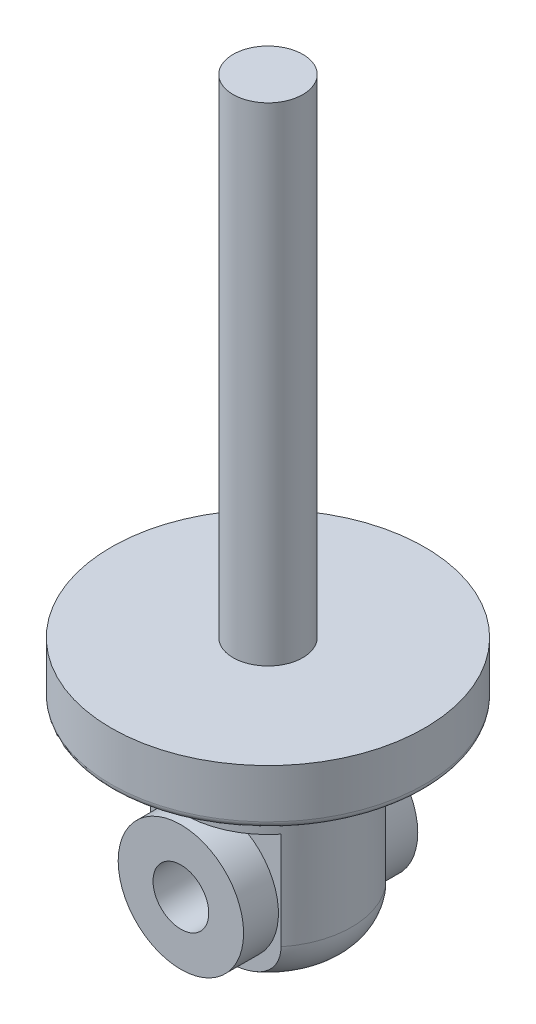
from build123d import *
from build123d.topology import SkipClean

# Parameters (mm, degrees)
SKETCH2_R               = 22.5
BOSS_EXTRUDE1_DEPTH     = 8
SKETCH3_R               = 5
BOSS_EXTRUDE2_DEPTH     = 70
SKETCH4_R               = 12
BOSS_EXTRUDE3_DEPTH     = 28
FILLET1_R               = 6
CUT_EXTRUDE1_DEPTH      = 85.240726493
CUT_EXTRUDE1_DEPTH_BACK = 85.240726493
SKETCH5_W               = 15
SKETCH5_H               = 20
SKETCH6_R               = 4
CUT_EXTRUDE2_DEPTH      = 28
SKETCH7_R               = 9
SKETCH7_R_2             = 4
BOSS_EXTRUDE5_DEPTH     = 12.5
FILLET3_R               = 1


with BuildPart() as part:
    # Sketch2 → Boss-Extrude1 (new body)
    with BuildSketch(Plane(origin=(0, 0, 0), x_dir=(1, 0, 0), z_dir=(0, 1, 0))):
        Circle(SKETCH2_R)
    extrude(amount=BOSS_EXTRUDE1_DEPTH)

    # Sketch3 → Boss-Extrude2 (add)
    with BuildSketch(Plane(origin=(0, 8, 0), x_dir=(1, 0, 0), z_dir=(0, 1, 0))):
        Circle(SKETCH3_R)
    extrude(amount=BOSS_EXTRUDE2_DEPTH)

    # Sketch4 → Boss-Extrude3 (add)
    with BuildSketch(Plane.XZ):
        Circle(SKETCH4_R)
    extrude(amount=BOSS_EXTRUDE3_DEPTH)

    # Fillet1
    fillet1_edges = [part.edges().sort_by_distance(p)[0] for p in [
        (-12, -28, 0),
    ]]
    fillet(fillet1_edges, radius=FILLET1_R)

    # Sketch5 → Cut-Extrude1 (cut, two sides: drawn at the far end of the back side and taken through both)
    with BuildSketch(Plane(origin=(0, 0, 0), x_dir=(0, 0, -1), z_dir=(1, 0, 0)).offset(-CUT_EXTRUDE1_DEPTH_BACK)):
        with Locations((15, -18)):
            Rectangle(SKETCH5_W, SKETCH5_H)
        with Locations((-15, -18)):
            Rectangle(SKETCH5_W, SKETCH5_H)
    extrude(amount=CUT_EXTRUDE1_DEPTH + CUT_EXTRUDE1_DEPTH_BACK, mode=Mode.SUBTRACT)

    # Sketch6 → Cut-Extrude2 (cut)
    with BuildSketch(Plane(origin=(0, 0, -7.5), x_dir=(-1, 0, 0), z_dir=(0, 0, -1))):
        with Locations((0, -18)):
            Circle(SKETCH6_R)
    extrude(amount=-CUT_EXTRUDE2_DEPTH, mode=Mode.SUBTRACT)

    # Sketch7 → Boss-Extrude5 (add, symmetric)
    with SkipClean():  # the faces are left unmerged after this step: merging them gives an invalid solid
        with BuildSketch(Plane.XY):
            with Locations((0, -18)):
                Circle(SKETCH7_R)
            with Locations((0, -18)):
                Circle(SKETCH7_R_2, mode=Mode.SUBTRACT)
        extrude(amount=BOSS_EXTRUDE5_DEPTH, both=True)
    add(part.part.scale(1), mode=Mode.REPLACE)  # the faces are merged on a copy

    # Fillet3
    fillet3_edges = [part.edges().sort_by_distance(p)[0] for p in [
        (-22.5, 0, 0),
    ]]
    fillet(fillet3_edges, radius=FILLET3_R)


solid = part.part
